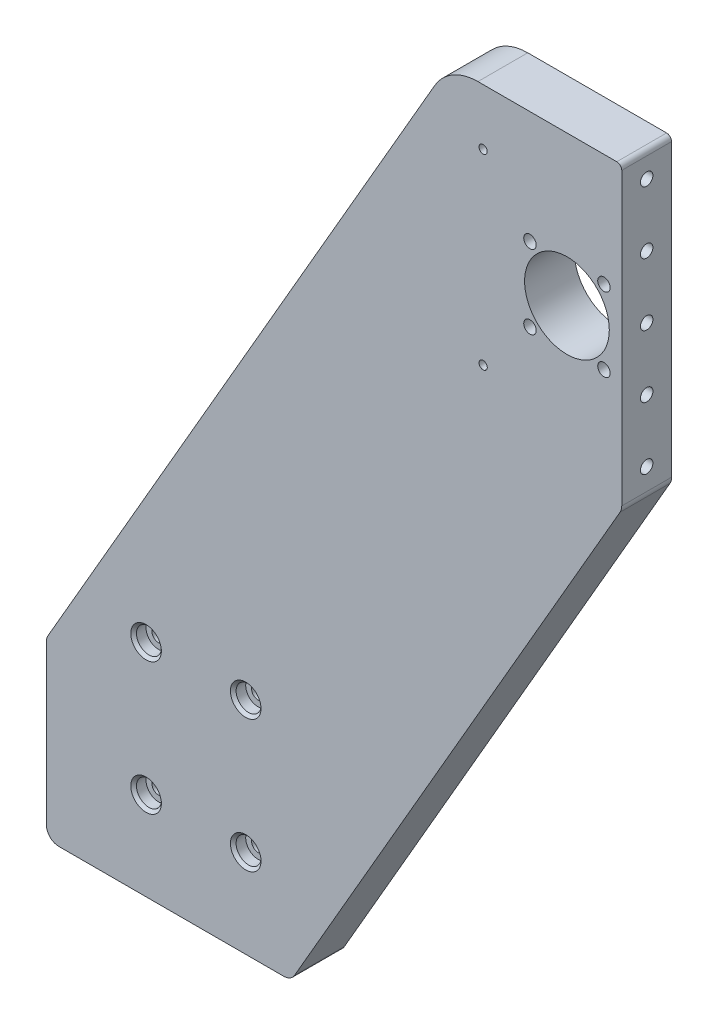
from build123d import *

# Parameters (mm, degrees)
SCHIZZO1_R                    = 17
SCHIZZO1_R_2                  = 2.5
ESTRUSIONE_ESTRUSIONE2_DEPTH  = 20
M5_TAPPED_HOLE1_D             = 4.2
M5_TAPPED_HOLE1_DEPTH         = 17.4
M5_TAPPED_HOLE1_TIP           = 1.2618073
CBORE_FOR_M5_SHCS1_AT_2_COUNT = 2
CBORE_FOR_M5_SHCS1_AT_2_PITCH = 53
CBORE_FOR_M5_SHCS1_AT_3_COUNT = 2
CBORE_FOR_M5_SHCS1_AT_3_PITCH = 66.400301204
CBORE_FOR_M5_SHCS1_AT_4_COUNT = 2
CBORE_FOR_M5_SHCS1_AT_4_PITCH = 40
M6_TAPPED_HOLE1_D             = 5
M6_TAPPED_HOLE1_DEPTH         = 19
M6_TAPPED_HOLE1_TIP           = 1.502151548
M4_TAPPED_HOLE1_D             = 3.3


with BuildPart() as part:
    # Schizzo1 → Estrusione-Estrusione2 (new body)
    with BuildSketch(Plane.XY):
        with BuildLine():
            Line((5, 0), (95.262794416, 0))
            ThreePointArc((95.262794416, 0), (97.762794416, 0.669872981), (99.592921435, 2.5))
            Line((99.592921435, 2.5), (230.270234695, 228.839745962))
            ThreePointArc((230.270234695, 228.839745962), (230.769736807, 230.045650737), (230.940107676, 231.339745962))
            Line((230.940107676, 231.339745962), (230.940107676, 348))
            ThreePointArc((230.940107676, 348), (230.354321238, 349.414213562), (228.940107676, 350))
            Line((228.940107676, 350), (173.205080757, 350))
            ThreePointArc((173.205080757, 350), (163.205080757, 347.320508076), (155.884572681, 340))
            Line((155.884572681, 340), (0.669872981, 71.160254038))
            ThreePointArc((0.669872981, 71.160254038), (0.170370869, 69.954349263), (0, 68.660254038))
            Line((0, 68.660254038), (0, 5))
            ThreePointArc((0, 5), (1.464466094, 1.464466094), (5, 0))
        make_face()
        with Locations((208.940107676, 290)):
            Circle(SCHIZZO1_R, mode=Mode.SUBTRACT)
        with Locations((223.789350081, 304.849242405)):
            Circle(SCHIZZO1_R_2, mode=Mode.SUBTRACT)
        with Locations((223.789350081, 275.150757595)):
            Circle(SCHIZZO1_R_2, mode=Mode.SUBTRACT)
        with Locations((194.090865271, 275.150757595)):
            Circle(SCHIZZO1_R_2, mode=Mode.SUBTRACT)
        with Locations((194.090865271, 304.849242405)):
            Circle(SCHIZZO1_R_2, mode=Mode.SUBTRACT)
    extrude(amount=-ESTRUSIONE_ESTRUSIONE2_DEPTH)

    # M5 Tapped Hole1
    with Locations(Plane(origin=(50.131397208, 0, -10), x_dir=(0, 0, -1), z_dir=(0, -1, 0))):
        with Locations((0, 0), (0, 35), (0, -35)):
            Hole(M5_TAPPED_HOLE1_D / 2, depth=M5_TAPPED_HOLE1_DEPTH)
            with Locations((0, 0, -(M5_TAPPED_HOLE1_DEPTH + M5_TAPPED_HOLE1_TIP / 2))):  # 118° drill point
                Cone(0, M5_TAPPED_HOLE1_D / 2, M5_TAPPED_HOLE1_TIP, mode=Mode.SUBTRACT)

    # Sketch5 → CBORE for M5 SHCS1 (revolve, cut)
    with BuildSketch(Plane(origin=(80, 88.5, 0), x_dir=(0, -1, 0), z_dir=(1, 0, 0))):
        Polygon((0, 0), (0, 20), (2.65, 20), (2.65, 5), (5, 5), (5, 1.145), (6.145, 0), align=None)
    cbore_for_m5_shcs1 = revolve(axis=Axis((80, 88.5, 6.35), (0, 0, -1)), mode=Mode.SUBTRACT)

    # CBORE for M5 SHCS1 at 2: CBORE for M5 SHCS1 ×2
    with Locations(*[(0, -i * CBORE_FOR_M5_SHCS1_AT_2_PITCH, 0) for i in range(1, CBORE_FOR_M5_SHCS1_AT_2_COUNT)]):
        add(cbore_for_m5_shcs1, mode=Mode.SUBTRACT)

    # CBORE for M5 SHCS1 at 3: CBORE for M5 SHCS1 ×2
    with Locations(*[Vector(-0.6024069059118463, -0.7981891503332503, 0) * (i * CBORE_FOR_M5_SHCS1_AT_3_PITCH) for i in range(1, CBORE_FOR_M5_SHCS1_AT_3_COUNT)]):
        add(cbore_for_m5_shcs1, mode=Mode.SUBTRACT)

    # CBORE for M5 SHCS1 at 4: CBORE for M5 SHCS1 ×2
    with Locations(*[(-i * CBORE_FOR_M5_SHCS1_AT_4_PITCH, 0, 0) for i in range(1, CBORE_FOR_M5_SHCS1_AT_4_COUNT)]):
        add(cbore_for_m5_shcs1, mode=Mode.SUBTRACT)

    # M6 Tapped Hole1
    with Locations(Plane(origin=(230.940107676, 340, -10), x_dir=(0, 0, 1), z_dir=(1, 0, 0))):
        with Locations((0, 0), (0, 25), (0, 50), (0, 75), (0, 100)):
            Hole(M6_TAPPED_HOLE1_D / 2, depth=M6_TAPPED_HOLE1_DEPTH)
            with Locations((0, 0, -(M6_TAPPED_HOLE1_DEPTH + M6_TAPPED_HOLE1_TIP / 2))):  # 118° drill point
                Cone(0, M6_TAPPED_HOLE1_D / 2, M6_TAPPED_HOLE1_TIP, mode=Mode.SUBTRACT)

    # M4 Tapped Hole1 (through all)
    with Locations(Plane(origin=(175.288579616, 327.50684833, 0), x_dir=(1, 0, 0), z_dir=(0, 0, 1))):
        with Locations((0, 0), (0.024506359, -75.035669595)):
            Hole(M4_TAPPED_HOLE1_D / 2)


solid = part.part
